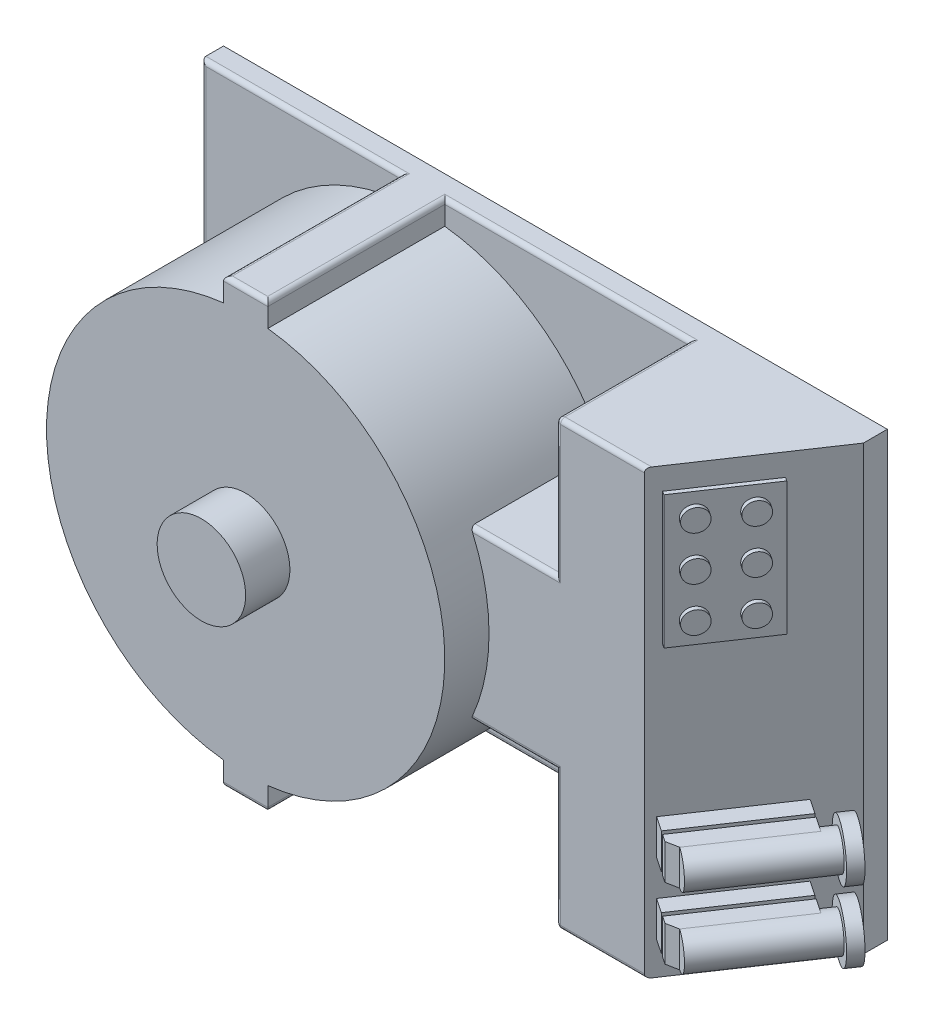
from build123d import *
from build123d.topology import SkipClean

# Parameters (mm, degrees)
SKETCH1_W             = 150
SKETCH1_H             = 100
BOSS_EXTRUDE1_DEPTH   = 5
SKETCH2_R             = 45
BOSS_EXTRUDE2_DEPTH   = 40
SKETCH3_W             = 10
SKETCH3_H             = 100
BOSS_EXTRUDE3_DEPTH   = 40
SKETCH4_R             = 10
BOSS_EXTRUDE4_DEPTH   = 10
SKETCH5_W             = 79.676671077
SKETCH5_H             = 100
BOSS_EXTRUDE5_DEPTH   = 30
CUT_EXTRUDE1_START    = -30
CUT_EXTRUDE1_DEPTH    = 30
CUT_EXTRUDE2_DEPTH    = 100
SKETCH8_W             = 30
SKETCH8_H             = 20
BOSS_EXTRUDE6_DEPTH   = 1
SKETCH9_R             = 2.5
BOSS_EXTRUDE7_DEPTH   = 1
SKETCH10_W            = 8
SKETCH10_H            = 25
BOSS_EXTRUDE8_DEPTH   = 4
SKETCH11_W            = 6
SKETCH11_H            = 23
BOSS_EXTRUDE9_DEPTH   = 1
SKETCH12_W            = 8
SKETCH12_H            = 25
BOSS_EXTRUDE10_DEPTH  = 4
CUT_EXTRUDE3_DEPTH    = 8
SKETCH14_R            = 4
BOSS_EXTRUDE11_DEPTH  = 23
BOSS_EXTRUDE12_START  = 3
BOSS_EXTRUDE12_DEPTH  = 3
SKETCH16_R            = 6
SKETCH16_R_2          = 4
BOSS_EXTRUDE13_DEPTH  = 3
MIRROR2_START         = 3.718237914
MIRROR2_OUTLINE_W     = 4
MIRROR2_OUTLINE_H     = 8
MIRROR2_DEPTH         = 25
MIRROR2_START_2       = 4.718237914
MIRROR2_2_OUTLINE_W   = 1
MIRROR2_2_OUTLINE_H   = 6
MIRROR2_2_DEPTH       = 23
MIRROR2_START_3       = 28.718237914
MIRROR2_3_DEPTH       = 3
MIRROR2_START_4       = 18
MIRROR2_4_DEPTH       = 10
SKETCH17_R            = 6
SKETCH17_R_2          = 4
BOSS_EXTRUDE14_DEPTH  = 3
FILLET1_R             = 1
BODY_MOVE_COPY2_ANGLE = 90


with BuildPart() as part:
    # Sketch1 → Boss-Extrude1 (new body)
    with BuildSketch(Plane(origin=(0, 0, 0), x_dir=(1, 0, 0), z_dir=(0, 1, 0))):
        Rectangle(SKETCH1_W, SKETCH1_H)
    extrude(amount=BOSS_EXTRUDE1_DEPTH)

    # Sketch2 → Boss-Extrude2 (add)
    with BuildSketch(Plane(origin=(0, 5, 0), x_dir=(1, 0, 0), z_dir=(0, 1, 0))):
        with Locations(Location((-25, 0, 0), (0, 0, 270))):
            Circle(SKETCH2_R)
    extrude(amount=BOSS_EXTRUDE2_DEPTH)

    # Sketch3 → Boss-Extrude3 (add)
    with BuildSketch(Plane(origin=(0, 45, 0), x_dir=(1, 0, 0), z_dir=(0, 1, 0))):
        with Locations((-25, 0)):
            Rectangle(SKETCH3_W, SKETCH3_H)
    extrude(amount=-BOSS_EXTRUDE3_DEPTH)

    # Sketch4 → Boss-Extrude4 (add)
    with BuildSketch(Plane(origin=(0, 45, 0), x_dir=(1, 0, 0), z_dir=(0, 1, 0))):
        with Locations(Location((-25, 0, 0), (0, 0, 270))):
            Circle(SKETCH4_R)
    extrude(amount=BOSS_EXTRUDE4_DEPTH)

    # Sketch5 → Boss-Extrude5 (add)
    with BuildSketch(Plane(origin=(0, 5, 0), x_dir=(1, 0, 0), z_dir=(0, 1, 0))):
        with Locations((35.161664462, 0)):
            Rectangle(SKETCH5_W, SKETCH5_H)
    extrude(amount=BOSS_EXTRUDE5_DEPTH)

    # Sketch6 → Cut-Extrude1 (cut)
    with SkipClean():  # the faces are left unmerged after this step: merging them gives an invalid solid
        with BuildSketch(Plane(origin=(0, 35, 0), x_dir=(1, 0, 0), z_dir=(0, 1, 0)).offset(CUT_EXTRUDE1_START)):
            with BuildLine():
                Line((35.161664462, -50), (35.161664462, -18.923812471))
                Line((35.161664462, -18.923812471), (15.82755591, -18.923812471))
                ThreePointArc((15.82755591, -18.923812471), (7.364911277, -31.265196594), (-4.676671077, -40.149250323))
                Line((-4.676671077, -40.149250323), (-4.676671077, -50))
                Line((-4.676671077, -50), (35.161664462, -50))
            make_face()
            with BuildLine():
                Line((15.82755591, 18.923812471), (35.161664462, 18.923812471))
                Line((35.161664462, 18.923812471), (35.161664462, 50))
                Line((35.161664462, 50), (-4.676671077, 50))
                Line((-4.676671077, 50), (-4.676671077, 40.149250323))
                ThreePointArc((-4.676671077, 40.149250323), (7.364911277, 31.265196594), (15.82755591, 18.923812471))
            make_face()
        extrude(amount=CUT_EXTRUDE1_DEPTH, mode=Mode.SUBTRACT)

    # Sketch7 → Cut-Extrude2 (cut)
    with SkipClean():  # the faces are left unmerged after this step: merging them gives an invalid solid
        with BuildSketch(Plane.XY.offset(50)):
            Polygon((75, 5.403823717), (55.080832231, 35), (75, 35), align=None)
        extrude(amount=-CUT_EXTRUDE2_DEPTH, mode=Mode.SUBTRACT)

    # Sketch8 → Boss-Extrude6 (add)
    with SkipClean():  # the faces are left unmerged after this step: merging them gives an invalid solid
        with BuildSketch(Plane(origin=(54.121453052, 36.425458915, 0), x_dir=(0, 0, -1), z_dir=(0.8296050879958807, 0.5583506048813301, 0))):
            with Locations((30, -14.718237914)):
                Rectangle(SKETCH8_W, SKETCH8_H)
        extrude(amount=BOSS_EXTRUDE6_DEPTH)

    # Sketch9 → Boss-Extrude7 (add)
    with SkipClean():  # the faces are left unmerged after this step: merging them gives an invalid solid
        with BuildSketch(Plane(origin=(54.95105814, 36.98380952, 0), x_dir=(0, 0, -1), z_dir=(0.8296050879958805, 0.5583506048813301, 0))):
            with Locations(Location((20, -9.718237914, 0), (0, 0, 90))):
                Circle(SKETCH9_R)
            with Locations(Location((30, -9.718237914, 0), (0, 0, 90))):
                Circle(SKETCH9_R)
            with Locations(Location((40, -9.718237914, 0), (0, 0, 90))):
                Circle(SKETCH9_R)
        boss_extrude7 = extrude(amount=BOSS_EXTRUDE7_DEPTH)

    # Mirror1: Boss-Extrude7 across plane
    with SkipClean():  # the faces are left unmerged after this step: merging them gives an invalid solid
        add(boss_extrude7.mirror(Plane(origin=(8.217937042, -12.210325059, 0), x_dir=(0, 0, 1), z_dir=(0.5583506048813301, -0.8296050879958805, 0))))

    # Sketch10 → Boss-Extrude8 (add)
    with SkipClean():  # the faces are left unmerged after this step: merging them gives an invalid solid
        with BuildSketch(Plane(origin=(54.121453052, 36.425458915, 0), x_dir=(0, 0, -1), z_dir=(0.8296050879958807, 0.5583506048813301, 0))):
            with Locations((-38.555447602, -16.218237914)):
                Rectangle(SKETCH10_W, SKETCH10_H)
        extrude(amount=BOSS_EXTRUDE8_DEPTH)

    # Sketch11 → Boss-Extrude9 (add)
    with SkipClean():  # the faces are left unmerged after this step: merging them gives an invalid solid
        with BuildSketch(Plane(origin=(57.439873404, 38.658861335, 0), x_dir=(0, 0, -1), z_dir=(0.8296050879958807, 0.5583506048813301, 0))):
            with Locations((-38.555447602, -16.218237914)):
                Rectangle(SKETCH11_W, SKETCH11_H)
        extrude(amount=BOSS_EXTRUDE9_DEPTH)

    # Sketch12 → Boss-Extrude10 (add)
    with SkipClean():  # the faces are left unmerged after this step: merging them gives an invalid solid
        with BuildSketch(Plane(origin=(58.269478492, 39.21721194, 0), x_dir=(0, 0, -1), z_dir=(0.8296050879958808, 0.5583506048813299, 0))):
            with Locations((-38.555447602, -16.218237914)):
                Rectangle(SKETCH12_W, SKETCH12_H)
        extrude(amount=BOSS_EXTRUDE10_DEPTH)

    # Sketch13 → Cut-Extrude3 (cut)
    with SkipClean():  # the faces are left unmerged after this step: merging them gives an invalid solid
        with BuildSketch(Plane.XY.offset(42.555447602)):
            Polygon((62.004769057, 37.249244058), (64.780680442, 36.706735092), (63.663979232, 38.365945268), align=None)
        extrude(amount=-CUT_EXTRUDE3_DEPTH, mode=Mode.SUBTRACT)

    # Sketch14 → Boss-Extrude11 (add)
    with SkipClean():  # the faces are left unmerged after this step: merging them gives an invalid solid
        with BuildSketch(Plane(origin=(16.03484551, -23.824796291, 0), x_dir=(0.8296050879958808, 0.5583506048813299, 0), z_dir=(0.5583506048813298, -0.8296050879958807, 0))):
            with Locations((74.237609841, 38.555447602)):
                Circle(SKETCH14_R)
        extrude(amount=-BOSS_EXTRUDE11_DEPTH)

    # Sketch15 → Boss-Extrude12 (add)
    with SkipClean():  # the faces are left unmerged after this step: merging them gives an invalid solid
        with BuildSketch(Plane(origin=(16.03484551, -23.824796291, 0), x_dir=(0.8296050879958808, 0.5583506048813299, 0), z_dir=(0.5583506048813298, -0.8296050879958807, 0)).offset(BOSS_EXTRUDE12_START)):
            with BuildLine():
                Line((72.237609841, 42.019549217), (72.237609841, 35.091345986))
                ThreePointArc((72.237609841, 35.091345986), (78.237609841, 38.555447602), (72.237609841, 42.019549217))
            make_face()
        extrude(amount=-BOSS_EXTRUDE12_DEPTH)

    # Mirror2: read off the stored shape, not the designer's step
    # Mirror2 outline → Mirror2 (add)
    with SkipClean():  # the faces are left unmerged after this step: merging them gives an invalid solid
        with BuildSketch(Plane(origin=(0, 0, 0), x_dir=(0.8296050879958807, 0.5583506048813299, 0), z_dir=(0.5583506048813299, -0.8296050879958807, 0)).offset(MIRROR2_START)):
            with Locations((67.237609841, 22.555447602)):
                Rectangle(MIRROR2_OUTLINE_W, MIRROR2_OUTLINE_H)
            with BuildLine():
                Line((70.237609841, 18.555447602), (74.237609841, 18.555447601))
                ThreePointArc((74.237609841, 18.555447601), (78.237609841, 22.555447602), (74.237609841, 26.555447602))
                Line((74.237609841, 26.555447602), (70.237609841, 26.555447602))
                Line((70.237609841, 26.555447602), (70.237609841, 18.555447602))
            make_face()
        extrude(amount=MIRROR2_DEPTH)

    # Mirror2 2 outline → Mirror2 2 (add)
    with SkipClean():  # the faces are left unmerged after this step: merging them gives an invalid solid
        with BuildSketch(Plane(origin=(0, 0, 0), x_dir=(0.8296050879958807, 0.5583506048813299, 0), z_dir=(0.5583506048813299, -0.8296050879958807, 0)).offset(MIRROR2_START_2)):
            with Locations((69.737609841, 22.555447602)):
                Rectangle(MIRROR2_2_OUTLINE_W, MIRROR2_2_OUTLINE_H)
        extrude(amount=MIRROR2_2_DEPTH)

    # Mirror2 3 outline → Mirror2 3 (add)
    with SkipClean():  # the faces are left unmerged after this step: merging them gives an invalid solid
        with BuildSketch(Plane(origin=(0, 0, 0), x_dir=(0.8296050879958807, 0.5583506048813299, 0), z_dir=(0.5583506048813299, -0.8296050879958807, 0)).offset(MIRROR2_START_3)):
            with BuildLine():
                ThreePointArc((72.237609841, 19.091345986), (78.237609841, 22.555447602), (72.237609841, 26.019549217))
                Line((72.237609841, 26.019549217), (72.237609841, 19.091345986))
            make_face()
        extrude(amount=MIRROR2_3_DEPTH)

    # Mirror2 4 outline → Mirror2 4 (cut)
    with SkipClean():  # the faces are left unmerged after this step: merging them gives an invalid solid
        with BuildSketch(Plane.XY.offset(MIRROR2_START_4)):
            Polygon((66.982399585, 40.599347687), (62.004769057, 37.249244058), (64.780680442, 36.706735092), (68.099100794, 38.940137511), (70, 40.219503123), (70, 42), (69.063508256, 42), align=None)
        extrude(amount=MIRROR2_4_DEPTH, mode=Mode.SUBTRACT)

    # Fillet1
    # the kernel refuses this fillet: 1 mm, written as the material it takes off along each edge
    with BuildSketch(Plane(origin=(36.161664462, 34, -49), x_dir=(0, 1, 0), z_dir=(0, 0, -1))) as fillet1_piece_1_section:
        Polygon((0, 0), (FILLET1_R, 0), (FILLET1_R, -FILLET1_R), (0, -FILLET1_R), align=None)
    fillet1_piece_1 = extrude(amount=FILLET1_R, mode=Mode.PRIVATE)
    fillet1_piece_1 = fillet1_piece_1 - Plane(origin=(36.161664462, 34, -49), x_dir=(0.7071067811865475, -0.7071067811865475, 0), z_dir=(0, 0, -1)) * Sphere(FILLET1_R, mode=Mode.PRIVATE)
    add(fillet1_piece_1, mode=Mode.SUBTRACT)
    with BuildSketch(Plane(origin=(36.161664462, 34, 49), x_dir=(0, 1, 0), z_dir=(0, 0, 1))) as fillet1_piece_2_section:
        Polygon((0, 0), (FILLET1_R, 0), (FILLET1_R, FILLET1_R), (0, FILLET1_R), align=None)
    fillet1_piece_2 = extrude(amount=FILLET1_R, mode=Mode.PRIVATE)
    fillet1_piece_2 = fillet1_piece_2 - Plane(origin=(36.161664462, 34, 49), x_dir=(0.7071067811865475, -0.7071067811865475, 0), z_dir=(0, 0, 1)) * Sphere(FILLET1_R, mode=Mode.PRIVATE)
    add(fillet1_piece_2, mode=Mode.SUBTRACT)
    with BuildSketch(Plane(origin=(57.580832231, 35, -50), x_dir=(0, -1, 0), z_dir=(-1, 0, 0)), Plane(origin=(36.161664462, 35, 50), x_dir=(0, -1, 0), z_dir=(1, 0, 0))) as fillet1_piece_3:
        with BuildLine():
            CenterArc((FILLET1_R, FILLET1_R), FILLET1_R, 180, 90)
            Line((0, FILLET1_R), (0, 0))
            Line((0, 0), (FILLET1_R, 0))
        make_face()
    extrude(amount=21.419167769, mode=Mode.SUBTRACT)
    with BuildSketch(Plane(origin=(-4.676671077, 5, 50), x_dir=(0, -1, 0), z_dir=(1, 0, 0)), Plane(origin=(35.161664462, 5, -50), x_dir=(0, -1, 0), z_dir=(-1, 0, 0))) as fillet1_piece_4:
        with BuildLine():
            CenterArc((FILLET1_R, FILLET1_R), FILLET1_R, 180, 90)
            Line((0, FILLET1_R), (0, 0))
            Line((0, 0), (FILLET1_R, 0))
        make_face()
    extrude(amount=39.838335538, mode=Mode.SUBTRACT)
    with BuildSketch(Plane(origin=(-77.5, 5, -50), x_dir=(0, -1, 0), z_dir=(1, 0, 0)), Plane(origin=(-30, 5, 50), x_dir=(0, -1, 0), z_dir=(-1, 0, 0))) as fillet1_piece_5:
        with BuildLine():
            CenterArc((FILLET1_R, -FILLET1_R), FILLET1_R, 90, 90)
            Line((0, -FILLET1_R), (0, 0))
            Line((0, 0), (FILLET1_R, 0))
        make_face()
    extrude(amount=47.5, mode=Mode.SUBTRACT)
    with BuildSketch(Plane(origin=(-32.5, 45, -50), x_dir=(0, -1, 0), z_dir=(1, 0, 0)), Plane(origin=(-17.5, 45, 50), x_dir=(0, -1, 0), z_dir=(-1, 0, 0))) as fillet1_piece_6:
        with BuildLine():
            CenterArc((FILLET1_R, -FILLET1_R), FILLET1_R, 90, 90)
            Line((0, -FILLET1_R), (0, 0))
            Line((0, 0), (FILLET1_R, 0))
        make_face()
    extrude(amount=15, mode=Mode.SUBTRACT)
    with BuildSketch(Plane(origin=(-30, 47.5, 50), x_dir=(1, 0, 0), z_dir=(0, -1, 0)), Plane(origin=(-20, 47.5, -50), x_dir=(-1, 0, 0), z_dir=(0, -1, 0))) as fillet1_piece_7:
        with BuildLine():
            CenterArc((FILLET1_R, -FILLET1_R), FILLET1_R, 90, 90)
            Line((0, -FILLET1_R), (0, 0))
            Line((0, 0), (FILLET1_R, 0))
        make_face()
    extrude(amount=42.5, mode=Mode.SUBTRACT)
    with BuildSketch(Plane(origin=(-30, 47.5, -50), x_dir=(1, 0, 0), z_dir=(0, -1, 0)), Plane(origin=(-20, 47.5, 50), x_dir=(-1, 0, 0), z_dir=(0, -1, 0))) as fillet1_piece_8:
        with BuildLine():
            CenterArc((FILLET1_R, FILLET1_R), FILLET1_R, 180, 90)
            Line((0, FILLET1_R), (0, 0))
            Line((0, 0), (FILLET1_R, 0))
        make_face()
    extrude(amount=42.5, mode=Mode.SUBTRACT)
    with BuildSketch(Plane(origin=(-75, 5, 52.5), x_dir=(0, -1, 0), z_dir=(0, 0, -1))) as fillet1_piece_9:
        with BuildLine():
            CenterArc((FILLET1_R, -FILLET1_R), FILLET1_R, 90, 90)
            Line((0, -FILLET1_R), (0, 0))
            Line((0, 0), (FILLET1_R, 0))
        make_face()
    extrude(amount=105, mode=Mode.SUBTRACT)
    with BuildSketch(Plane(origin=(35.161664462, 5, 50), x_dir=(1, 0, 0), z_dir=(0, 1, 0))) as fillet1_piece_10:
        with BuildLine():
            CenterArc((FILLET1_R, FILLET1_R), FILLET1_R, 180, 90)
            Line((0, FILLET1_R), (0, 0))
            Line((0, 0), (FILLET1_R, 0))
        make_face()
    extrude(amount=29, mode=Mode.SUBTRACT)
    with BuildSketch(Plane(origin=(35.161664462, 35, 49), x_dir=(1, 0, 0), z_dir=(0, 0, -1)), Plane(origin=(35.161664462, 35, -18.923812471), x_dir=(1, 0, 0), z_dir=(0, 0, -1))) as fillet1_piece_11:
        with BuildLine():
            CenterArc((FILLET1_R, FILLET1_R), FILLET1_R, 180, 90)
            Line((0, FILLET1_R), (0, 0))
            Line((0, 0), (FILLET1_R, 0))
        make_face()
    extrude(amount=30.076187529, mode=Mode.SUBTRACT)
    with BuildSketch(Plane(origin=(35.161664462, 35, 18.923812471), x_dir=(0, 0, -1), z_dir=(-1, 0, 0))) as fillet1_piece_12_section:
        with BuildLine():
            CenterArc((FILLET1_R, FILLET1_R), FILLET1_R, 180, 90)
            Line((0, FILLET1_R), (0, 0))
            Line((0, 0), (FILLET1_R, 0))
        make_face()
    fillet1_piece_12 = extrude(amount=21.834108552, mode=Mode.PRIVATE)
    fillet1_piece_12 = fillet1_piece_12 - Plane(origin=(-25, 35, 0), x_dir=(0, 0, 1), z_dir=(0, -1, 0)) * Cylinder(45, 48, mode=Mode.PRIVATE)
    add(fillet1_piece_12, mode=Mode.SUBTRACT)
    with BuildSketch(Plane(origin=(35.161664462, 5, -50), x_dir=(1, 0, 0), z_dir=(0, 1, 0))) as fillet1_piece_13:
        with BuildLine():
            CenterArc((FILLET1_R, -FILLET1_R), FILLET1_R, 90, 90)
            Line((0, -FILLET1_R), (0, 0))
            Line((0, 0), (FILLET1_R, 0))
        make_face()
    extrude(amount=29, mode=Mode.SUBTRACT)
    with BuildSketch(Plane(origin=(13.32755591, 35, -18.923812471), x_dir=(0, 0, 1), z_dir=(1, 0, 0))) as fillet1_piece_14_section:
        with BuildLine():
            CenterArc((FILLET1_R, FILLET1_R), FILLET1_R, 180, 90)
            Line((0, FILLET1_R), (0, 0))
            Line((0, 0), (FILLET1_R, 0))
        make_face()
    fillet1_piece_14 = extrude(amount=21.834108552, mode=Mode.PRIVATE)
    fillet1_piece_14 = fillet1_piece_14 - Plane(origin=(-25, 35, 0), x_dir=(0, 0, 1), z_dir=(0, -1, 0)) * Cylinder(45, 48, mode=Mode.PRIVATE)
    add(fillet1_piece_14, mode=Mode.SUBTRACT)
    with BuildSketch(Plane(origin=(-20, 5, -50), x_dir=(0, -1, 0), z_dir=(1, 0, 0)), Plane(origin=(-4.676671077, 5, 50), x_dir=(0, -1, 0), z_dir=(-1, 0, 0))) as fillet1_piece_15:
        with BuildLine():
            CenterArc((FILLET1_R, -FILLET1_R), FILLET1_R, 90, 90)
            Line((0, -FILLET1_R), (0, 0))
            Line((0, 0), (FILLET1_R, 0))
        make_face()
    extrude(amount=15.323328923, mode=Mode.SUBTRACT)
    with BuildSketch(Plane(origin=(-4.676671077, 5, 50), x_dir=(0, -1, 0), z_dir=(1, 0, 0))) as fillet1_piece_16a_section:
        with BuildLine():
            CenterArc((FILLET1_R, FILLET1_R), FILLET1_R, 180, 90)
            Line((0, FILLET1_R), (0, 0))
            Line((0, 0), (FILLET1_R, 0))
        make_face()
    fillet1_piece_16a = extrude(amount=42.338335538, mode=Mode.PRIVATE)
    fillet1_piece_16a = split(fillet1_piece_16a, bisect_by=Plane(origin=(35.161664462, 5, 50), z_dir=(1, 0, 0)), keep=Keep.TOP, mode=Mode.PRIVATE)
    with BuildSketch(Plane(origin=(35.161664462, 2.5, 50), x_dir=(1, 0, 0), z_dir=(0, 1, 0))) as fillet1_piece_16b_section:
        with BuildLine():
            CenterArc((FILLET1_R, FILLET1_R), FILLET1_R, 180, 90)
            Line((0, FILLET1_R), (0, 0))
            Line((0, 0), (FILLET1_R, 0))
        make_face()
    fillet1_piece_16b = extrude(amount=31.5, mode=Mode.PRIVATE)
    fillet1_piece_16b = split(fillet1_piece_16b, bisect_by=Plane(origin=(35.161664462, 5, 50), z_dir=(0, -1, 0)), keep=Keep.TOP, mode=Mode.PRIVATE)
    fillet1_piece_16 = fillet1_piece_16a & fillet1_piece_16b
    add(fillet1_piece_16, mode=Mode.SUBTRACT)
    with BuildSketch(Plane(origin=(-30, 47.5, -50), x_dir=(1, 0, 0), z_dir=(0, -1, 0))) as fillet1_piece_17a_section:
        with BuildLine():
            CenterArc((FILLET1_R, FILLET1_R), FILLET1_R, 180, 90)
            Line((0, FILLET1_R), (0, 0))
            Line((0, 0), (FILLET1_R, 0))
        make_face()
    fillet1_piece_17a = extrude(amount=45, mode=Mode.PRIVATE)
    fillet1_piece_17a = split(fillet1_piece_17a, bisect_by=Plane(origin=(-30, 5, -50), z_dir=(0, -1, 0)), keep=Keep.TOP, mode=Mode.PRIVATE)
    with BuildSketch(Plane(origin=(-77.5, 5, -50), x_dir=(0, -1, 0), z_dir=(1, 0, 0))) as fillet1_piece_17b_section:
        with BuildLine():
            CenterArc((FILLET1_R, -FILLET1_R), FILLET1_R, 90, 90)
            Line((0, -FILLET1_R), (0, 0))
            Line((0, 0), (FILLET1_R, 0))
        make_face()
    fillet1_piece_17b = extrude(amount=50, mode=Mode.PRIVATE)
    fillet1_piece_17b = split(fillet1_piece_17b, bisect_by=Plane(origin=(-30, 5, -50), z_dir=(1, 0, 0)), keep=Keep.TOP, mode=Mode.PRIVATE)
    fillet1_piece_17 = fillet1_piece_17a & fillet1_piece_17b
    add(fillet1_piece_17, mode=Mode.SUBTRACT)
    with BuildSketch(Plane(origin=(-27.5, 5, 50), x_dir=(0, -1, 0), z_dir=(-1, 0, 0))) as fillet1_piece_18a_section:
        with BuildLine():
            CenterArc((FILLET1_R, -FILLET1_R), FILLET1_R, 90, 90)
            Line((0, -FILLET1_R), (0, 0))
            Line((0, 0), (FILLET1_R, 0))
        make_face()
    fillet1_piece_18a = extrude(amount=50, mode=Mode.PRIVATE)
    fillet1_piece_18a = split(fillet1_piece_18a, bisect_by=Plane(origin=(-30, 5, 50), z_dir=(1, 0, 0)), keep=Keep.TOP, mode=Mode.PRIVATE)
    with BuildSketch(Plane(origin=(-30, 47.5, 50), x_dir=(1, 0, 0), z_dir=(0, -1, 0))) as fillet1_piece_18b_section:
        with BuildLine():
            CenterArc((FILLET1_R, -FILLET1_R), FILLET1_R, 90, 90)
            Line((0, -FILLET1_R), (0, 0))
            Line((0, 0), (FILLET1_R, 0))
        make_face()
    fillet1_piece_18b = extrude(amount=45, mode=Mode.PRIVATE)
    fillet1_piece_18b = split(fillet1_piece_18b, bisect_by=Plane(origin=(-30, 5, 50), z_dir=(0, -1, 0)), keep=Keep.TOP, mode=Mode.PRIVATE)
    fillet1_piece_18 = fillet1_piece_18a & fillet1_piece_18b
    add(fillet1_piece_18, mode=Mode.SUBTRACT)
    with BuildSketch(Plane(origin=(-22.5, 5, -50), x_dir=(0, -1, 0), z_dir=(1, 0, 0))) as fillet1_piece_19a_section:
        with BuildLine():
            CenterArc((FILLET1_R, -FILLET1_R), FILLET1_R, 90, 90)
            Line((0, -FILLET1_R), (0, 0))
            Line((0, 0), (FILLET1_R, 0))
        make_face()
    fillet1_piece_19a = extrude(amount=17.823328923, mode=Mode.PRIVATE)
    fillet1_piece_19a = split(fillet1_piece_19a, bisect_by=Plane(origin=(-20, 5, -50), z_dir=(-1, 0, 0)), keep=Keep.TOP, mode=Mode.PRIVATE)
    with BuildSketch(Plane(origin=(-20, 47.5, -50), x_dir=(-1, 0, 0), z_dir=(0, -1, 0))) as fillet1_piece_19b_section:
        with BuildLine():
            CenterArc((FILLET1_R, -FILLET1_R), FILLET1_R, 90, 90)
            Line((0, -FILLET1_R), (0, 0))
            Line((0, 0), (FILLET1_R, 0))
        make_face()
    fillet1_piece_19b = extrude(amount=45, mode=Mode.PRIVATE)
    fillet1_piece_19b = split(fillet1_piece_19b, bisect_by=Plane(origin=(-20, 5, -50), z_dir=(0, -1, 0)), keep=Keep.TOP, mode=Mode.PRIVATE)
    fillet1_piece_19 = fillet1_piece_19a & fillet1_piece_19b
    add(fillet1_piece_19, mode=Mode.SUBTRACT)
    with BuildSketch(Plane(origin=(-20, 47.5, 50), x_dir=(-1, 0, 0), z_dir=(0, -1, 0))) as fillet1_piece_20a_section:
        with BuildLine():
            CenterArc((FILLET1_R, FILLET1_R), FILLET1_R, 180, 90)
            Line((0, FILLET1_R), (0, 0))
            Line((0, 0), (FILLET1_R, 0))
        make_face()
    fillet1_piece_20a = extrude(amount=45, mode=Mode.PRIVATE)
    fillet1_piece_20a = split(fillet1_piece_20a, bisect_by=Plane(origin=(-20, 5, 50), z_dir=(0, -1, 0)), keep=Keep.TOP, mode=Mode.PRIVATE)
    with BuildSketch(Plane(origin=(-4.676671077, 5, 50), x_dir=(0, -1, 0), z_dir=(-1, 0, 0))) as fillet1_piece_20b_section:
        with BuildLine():
            CenterArc((FILLET1_R, -FILLET1_R), FILLET1_R, 90, 90)
            Line((0, -FILLET1_R), (0, 0))
            Line((0, 0), (FILLET1_R, 0))
        make_face()
    fillet1_piece_20b = extrude(amount=17.823328923, mode=Mode.PRIVATE)
    fillet1_piece_20b = split(fillet1_piece_20b, bisect_by=Plane(origin=(-20, 5, 50), z_dir=(-1, 0, 0)), keep=Keep.TOP, mode=Mode.PRIVATE)
    fillet1_piece_20 = fillet1_piece_20a & fillet1_piece_20b
    add(fillet1_piece_20, mode=Mode.SUBTRACT)
    with BuildSketch(Plane(origin=(35.161664462, 2.5, -50), x_dir=(1, 0, 0), z_dir=(0, 1, 0))) as fillet1_piece_21a_section:
        with BuildLine():
            CenterArc((FILLET1_R, -FILLET1_R), FILLET1_R, 90, 90)
            Line((0, -FILLET1_R), (0, 0))
            Line((0, 0), (FILLET1_R, 0))
        make_face()
    fillet1_piece_21a = extrude(amount=31.5, mode=Mode.PRIVATE)
    fillet1_piece_21a = split(fillet1_piece_21a, bisect_by=Plane(origin=(35.161664462, 5, -50), z_dir=(0, -1, 0)), keep=Keep.TOP, mode=Mode.PRIVATE)
    with BuildSketch(Plane(origin=(37.661664462, 5, -50), x_dir=(0, -1, 0), z_dir=(-1, 0, 0))) as fillet1_piece_21b_section:
        with BuildLine():
            CenterArc((FILLET1_R, FILLET1_R), FILLET1_R, 180, 90)
            Line((0, FILLET1_R), (0, 0))
            Line((0, 0), (FILLET1_R, 0))
        make_face()
    fillet1_piece_21b = extrude(amount=42.338335538, mode=Mode.PRIVATE)
    fillet1_piece_21b = split(fillet1_piece_21b, bisect_by=Plane(origin=(35.161664462, 5, -50), z_dir=(1, 0, 0)), keep=Keep.TOP, mode=Mode.PRIVATE)
    fillet1_piece_21 = fillet1_piece_21a & fillet1_piece_21b
    add(fillet1_piece_21, mode=Mode.SUBTRACT)
    with BuildSketch(Plane(origin=(35.161664462, 35, 49), x_dir=(1, 0, 0), z_dir=(0, 0, -1))) as fillet1_piece_22a_section:
        with BuildLine():
            CenterArc((FILLET1_R, FILLET1_R), FILLET1_R, 180, 90)
            Line((0, FILLET1_R), (0, 0))
            Line((0, 0), (FILLET1_R, 0))
        make_face()
    fillet1_piece_22a = extrude(amount=32.576187529, mode=Mode.PRIVATE)
    fillet1_piece_22a = split(fillet1_piece_22a, bisect_by=Plane(origin=(35.161664462, 35, 18.923812471), z_dir=(0, 0, -1)), keep=Keep.TOP, mode=Mode.PRIVATE)
    with BuildSketch(Plane(origin=(37.661664462, 35, 18.923812471), x_dir=(0, 0, -1), z_dir=(-1, 0, 0))) as fillet1_piece_22b_section:
        with BuildLine():
            CenterArc((FILLET1_R, FILLET1_R), FILLET1_R, 180, 90)
            Line((0, FILLET1_R), (0, 0))
            Line((0, 0), (FILLET1_R, 0))
        make_face()
    fillet1_piece_22b = extrude(amount=24.334108552, mode=Mode.PRIVATE)
    fillet1_piece_22b = split(fillet1_piece_22b, bisect_by=Plane(origin=(35.161664462, 35, 18.923812471), z_dir=(1, 0, 0)), keep=Keep.TOP, mode=Mode.PRIVATE)
    fillet1_piece_22 = fillet1_piece_22a & fillet1_piece_22b
    add(fillet1_piece_22, mode=Mode.SUBTRACT)
    with BuildSketch(Plane(origin=(13.32755591, 35, -18.923812471), x_dir=(0, 0, 1), z_dir=(1, 0, 0))) as fillet1_piece_23a_section:
        with BuildLine():
            CenterArc((FILLET1_R, FILLET1_R), FILLET1_R, 180, 90)
            Line((0, FILLET1_R), (0, 0))
            Line((0, 0), (FILLET1_R, 0))
        make_face()
    fillet1_piece_23a = extrude(amount=24.334108552, mode=Mode.PRIVATE)
    fillet1_piece_23a = split(fillet1_piece_23a, bisect_by=Plane(origin=(35.161664462, 35, -18.923812471), z_dir=(1, 0, 0)), keep=Keep.TOP, mode=Mode.PRIVATE)
    with BuildSketch(Plane(origin=(35.161664462, 35, -16.423812471), x_dir=(1, 0, 0), z_dir=(0, 0, -1))) as fillet1_piece_23b_section:
        with BuildLine():
            CenterArc((FILLET1_R, FILLET1_R), FILLET1_R, 180, 90)
            Line((0, FILLET1_R), (0, 0))
            Line((0, 0), (FILLET1_R, 0))
        make_face()
    fillet1_piece_23b = extrude(amount=32.576187529, mode=Mode.PRIVATE)
    fillet1_piece_23b = split(fillet1_piece_23b, bisect_by=Plane(origin=(35.161664462, 35, -18.923812471), z_dir=(0, 0, 1)), keep=Keep.TOP, mode=Mode.PRIVATE)
    fillet1_piece_23 = fillet1_piece_23a & fillet1_piece_23b
    add(fillet1_piece_23, mode=Mode.SUBTRACT)


with BuildPart() as body_2:
    # Sketch16 → Boss-Extrude13 (new body)
    with BuildSketch(Plane(origin=(17.709897325, -26.313611555, 0), x_dir=(0.8296050879958806, 0.55835060488133, 0), z_dir=(0.55835060488133, -0.8296050879958806, 0))):
        with Locations((74.237609841, 38.555447602)):
            Circle(SKETCH16_R)
        with Locations((74.237609841, 38.555447602)):
            Circle(SKETCH16_R_2, mode=Mode.SUBTRACT)
    extrude(amount=BOSS_EXTRUDE13_DEPTH)


with BuildPart() as body_3:
    # Sketch17 → Boss-Extrude14 (new body)
    with BuildSketch(Plane(origin=(17.709897325, -26.313611555, 0), x_dir=(0.8296050879958806, 0.55835060488133, 0), z_dir=(0.55835060488133, -0.8296050879958806, 0))):
        with Locations((74.237609841, 22.555447602)):
            Circle(SKETCH17_R)
        with Locations((74.237609841, 22.555447602)):
            Circle(SKETCH17_R_2, mode=Mode.SUBTRACT)
    extrude(amount=BOSS_EXTRUDE14_DEPTH)


with BuildPart() as body_3_1:
    # Body-Move/Copy1: moved
    add(body_3.part.moved(Location((25, 0, 0))))


with BuildPart() as body_2_1:
    # Body-Move/Copy1: moved
    add(body_2.part.moved(Location((25, 0, 0))))


with BuildPart() as part_1:
    # Body-Move/Copy1: moved
    add(part.part.moved(Location((25, 0, 0))))


with BuildPart() as body_3_2:
    # Body-Move/Copy2: moved
    add(body_3_1.part.rotate(Axis((0, 0, 0), (1, 0, 0)), BODY_MOVE_COPY2_ANGLE))


with BuildPart() as body_2_2:
    # Body-Move/Copy2: moved
    add(body_2_1.part.rotate(Axis((0, 0, 0), (1, 0, 0)), BODY_MOVE_COPY2_ANGLE))


with BuildPart() as part_2:
    # Body-Move/Copy2: moved
    add(part_1.part.rotate(Axis((0, 0, 0), (1, 0, 0)), BODY_MOVE_COPY2_ANGLE))


solid = Compound([body_3_2.part, body_2_2.part, part_2.part])
